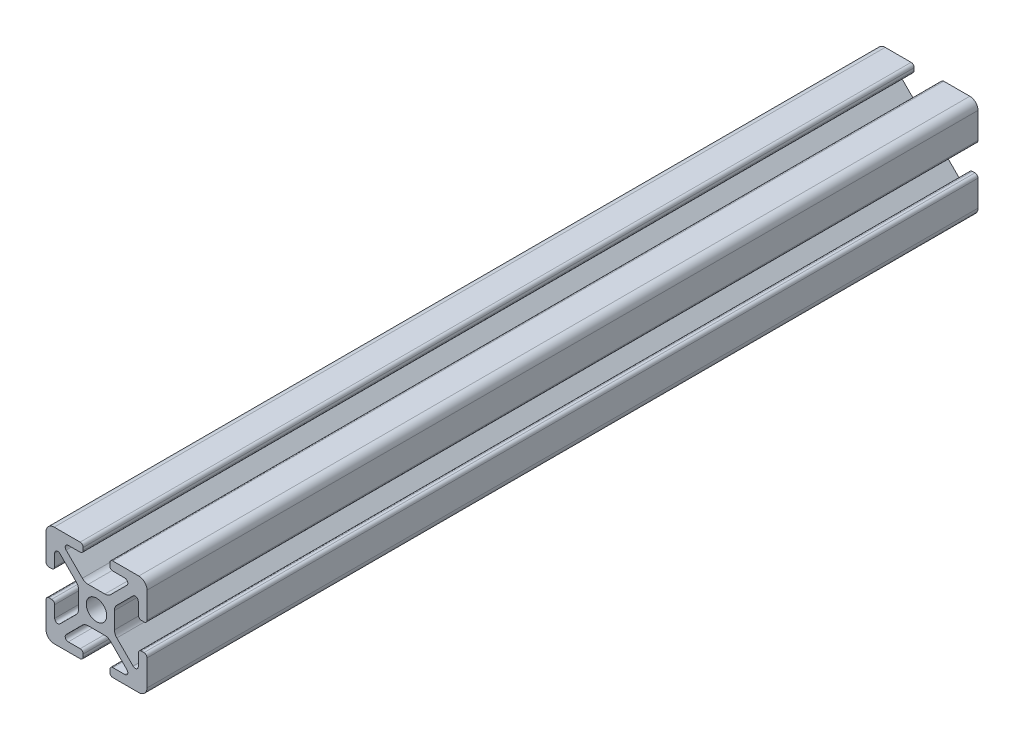
from build123d import *

# Parameters (mm, degrees)
SKETCH2_W            = 8.76
SKETCH2_H            = 8.76
SKETCH2_R            = 2.5
BOSS_EXTRUDE1_DEPTH  = 101.6
BOSS_EXTRUDE2_START  = -101.6
BOSS_EXTRUDE2_DEPTH  = 203.2
FILLET1_R            = 0.75
FILLET1_OF_MIRROR1_R = 0.75
MIRROR2_START        = -101.6
MIRROR2_DEPTH        = 203.2
FILLET2_R            = 2


# Read off the part's stored shape, not the designer's step: Mirror2
with BuildPart() as part:
    # Sketch2 → Boss-Extrude1 (new, symmetric)
    with BuildSketch(Plane.XY):
        Rectangle(SKETCH2_W, SKETCH2_H)
        Circle(SKETCH2_R, mode=Mode.SUBTRACT)
    extrude(amount=BOSS_EXTRUDE1_DEPTH, both=True)

    # Sketch3 → Boss-Extrude2 (add)
    with BuildSketch(Plane.XY.offset(BOSS_EXTRUDE2_START)):
        Polygon((3.25, 12.35), (12.35, 12.35), (12.35, 3.25), (10.22, 3.25), (10.22, 8.713862556), (4.38, 2.873862556), (4.38, 4.38), (2.873862556, 4.38), (8.713862556, 10.22), (3.25, 10.22), align=None)
    boss_extrude2 = extrude(amount=BOSS_EXTRUDE2_DEPTH)

    # Fillet1
    fillet1_edges = [part.edges().sort_by_distance(p)[0] for p in [
        (3.25, 12.35, 0),
        (3.25, 10.22, 0),
        (8.713862556, 10.22, 0),
        (10.22, 8.713862556, 0),
        (10.22, 3.25, 0),
        (12.35, 3.25, 0),
    ]]
    fillet(fillet1_edges, radius=FILLET1_R)

    # Mirror1: Boss-Extrude2 across plane
    add(boss_extrude2.mirror(Plane.ZX))

    # Fillet1 of Mirror1
    fillet1_of_mirror1_edges = [part.edges().sort_by_distance(p)[0] for p in [
        (3.25, -12.35, 0),
        (3.25, -10.22, 0),
        (8.713862556, -10.22, 0),
        (10.22, -8.713862556, 0),
        (10.22, -3.25, 0),
        (12.35, -3.25, 0),
    ]]
    fillet(fillet1_of_mirror1_edges, radius=FILLET1_OF_MIRROR1_R)

    # Mirror2 outline → Mirror2 (add)
    with BuildSketch(Plane.XY.offset(MIRROR2_START)):
        with BuildLine():
            ThreePointArc((-7.43353247, 8.939669914), (-7.596112034, 9.757012574), (-6.903202384, 10.22))
            Line((-6.903202384, 10.22), (-4, 10.22))
            ThreePointArc((-4, 10.22), (-3.469669914, 10.439669914), (-3.25, 10.97))
            Line((-3.25, 10.97), (-3.25, 11.6))
            ThreePointArc((-3.25, 11.6), (-3.469669914, 12.130330086), (-4, 12.35))
            Line((-4, 12.35), (-12.35, 12.35))
            Line((-12.35, 12.35), (-12.35, 4))
            ThreePointArc((-12.35, 4), (-12.130330086, 3.469669914), (-11.6, 3.25))
            Line((-11.6, 3.25), (-10.97, 3.25))
            ThreePointArc((-10.97, 3.25), (-10.439669914, 3.469669914), (-10.22, 4))
            Line((-10.22, 4), (-10.22, 6.903202384))
            ThreePointArc((-10.22, 6.903202384), (-9.757012574, 7.596112034), (-8.939669914, 7.43353247))
            Line((-8.939669914, 7.43353247), (-4.38, 2.873862556))
            Line((-4.38, 2.873862556), (-4.38, 4.38))
            Line((-4.38, 4.38), (-2.873862556, 4.38))
            Line((-2.873862556, 4.38), (-7.43353247, 8.939669914))
        make_face()
        with BuildLine():
            Line((-4.38, -4.38), (-4.38, -2.873862556))
            Line((-4.38, -2.873862556), (-8.939669914, -7.43353247))
            ThreePointArc((-8.939669914, -7.43353247), (-9.757012574, -7.596112034), (-10.22, -6.903202384))
            Line((-10.22, -6.903202384), (-10.22, -4))
            ThreePointArc((-10.22, -4), (-10.439669914, -3.469669914), (-10.97, -3.25))
            Line((-10.97, -3.25), (-11.6, -3.25))
            ThreePointArc((-11.6, -3.25), (-12.130330086, -3.469669914), (-12.35, -4))
            Line((-12.35, -4), (-12.35, -12.35))
            Line((-12.35, -12.35), (-4, -12.35))
            ThreePointArc((-4, -12.35), (-3.469669914, -12.130330086), (-3.25, -11.6))
            Line((-3.25, -11.6), (-3.25, -10.97))
            ThreePointArc((-3.25, -10.97), (-3.469669914, -10.439669914), (-4, -10.22))
            Line((-4, -10.22), (-6.903202384, -10.22))
            ThreePointArc((-6.903202384, -10.22), (-7.596112034, -9.757012574), (-7.43353247, -8.939669914))
            Line((-7.43353247, -8.939669914), (-2.873862556, -4.38))
            Line((-2.873862556, -4.38), (-4.38, -4.38))
        make_face()
    extrude(amount=MIRROR2_DEPTH)

    # Fillet2
    fillet2_edges = [part.edges().sort_by_distance(p)[0] for p in [
        (-2.873862556, -4.38, 0),
        (-4.38, -2.873862556, 0),
        (-12.35, -12.35, 0),
        (2.873862556, 4.38, 0),
        (4.38, 2.873862556, 0),
        (12.35, 12.35, 0),
        (-2.873862556, 4.38, 0),
        (-4.38, 2.873862556, 0),
        (-12.35, 12.35, 0),
        (2.873862556, -4.38, 0),
        (4.38, -2.873862556, 0),
        (12.35, -12.35, 0),
    ]]
    fillet(fillet2_edges, radius=FILLET2_R)


solid = part.part
